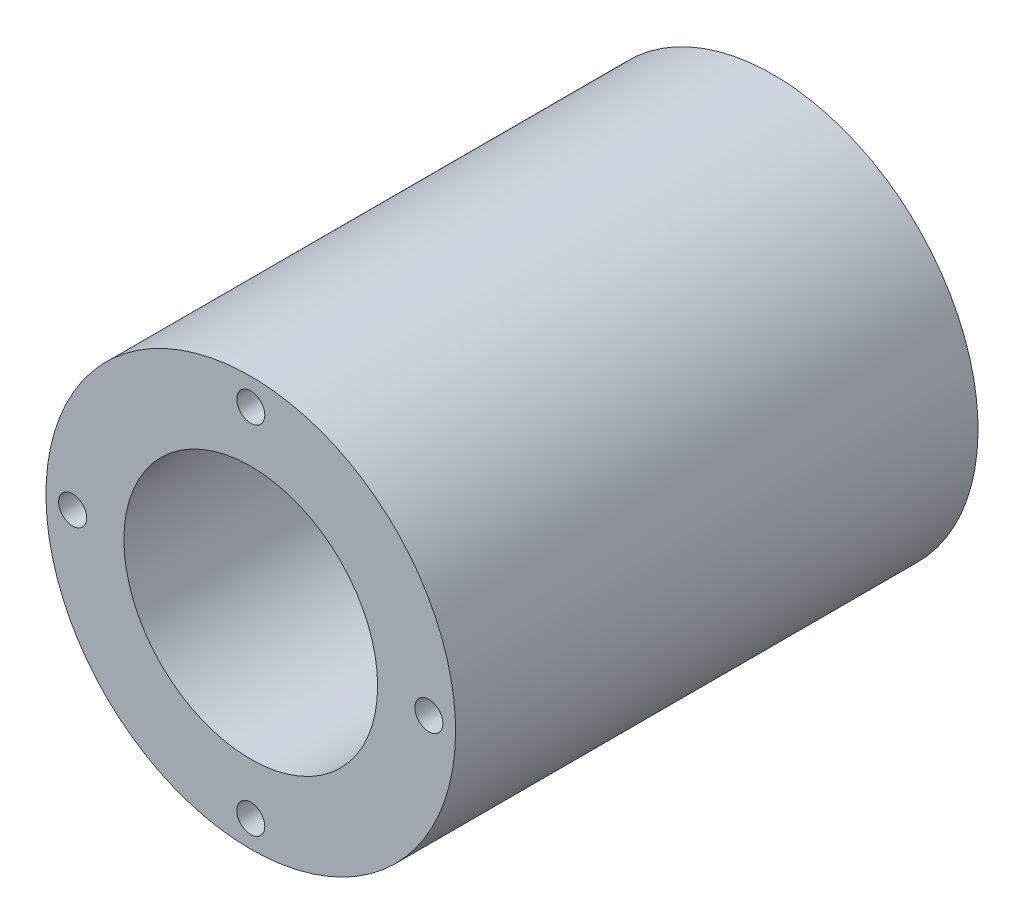
from build123d import *

# Parameters (mm, degrees)
SKETCH1_W              = 93.14800014
SKETCH1_H              = 13.8938
BACKFACEPATTERN_COUNT  = 6
FRONTFACEPATTERN_COUNT = 4


with BuildPart() as part:
    # Sketch1 → Revolve1 (revolve)
    with BuildSketch(Plane(origin=(0, 0, 0), x_dir=(0, 0, -1), z_dir=(1, 0, 0))):
        with Locations((-72.895000006, 29.5656)):
            Rectangle(SKETCH1_W, SKETCH1_H)
    revolve(axis=Axis((0, 0, 119.469000076), (0, 0, -1)))

    # Sketch9 → M6x1.0 Tapped Hole3 (revolve, cut)
    with BuildSketch(Plane(origin=(0, 30.565600032, 26.320999936), x_dir=(0, 1, 0), z_dir=(1, 0, 0))):
        Polygon((0, 0), (0, 16.502151548), (2.5, 15), (2.5, 0), align=None)
    m6x1_0_tapped_hole3 = revolve(axis=Axis((0, 30.565600032, 19.970999936), (0, 0, 1)), mode=Mode.SUBTRACT)

    # BackFacePattern: M6x1.0 Tapped Hole3 ×6 about axis
    backfacepattern_axis = Axis((0, 0, 1000), (0, 0, -1))
    for i in range(1, BACKFACEPATTERN_COUNT):
        add(m6x1_0_tapped_hole3.rotate(backfacepattern_axis, i * 360 / BACKFACEPATTERN_COUNT), mode=Mode.SUBTRACT)

    # Sketch6 → M6x1.0 Tapped Hole2 (revolve, cut)
    with BuildSketch(Plane(origin=(0, 31.75, 119.469000076), x_dir=(0, -1, 0), z_dir=(1, 0, 0))):
        Polygon((0, 0), (0, 16.502151548), (2.5, 15), (2.5, 0), align=None)
    m6x1_0_tapped_hole2 = revolve(axis=Axis((0, 31.75, 125.819000076), (0, 0, -1)), mode=Mode.SUBTRACT)

    # FrontFacePattern: M6x1.0 Tapped Hole2 ×4 about axis
    frontfacepattern_axis = Axis((0, 0, 1000), (0, 0, -1))
    for i in range(1, FRONTFACEPATTERN_COUNT):
        add(m6x1_0_tapped_hole2.rotate(frontfacepattern_axis, i * 360 / FRONTFACEPATTERN_COUNT), mode=Mode.SUBTRACT)


solid = part.part
